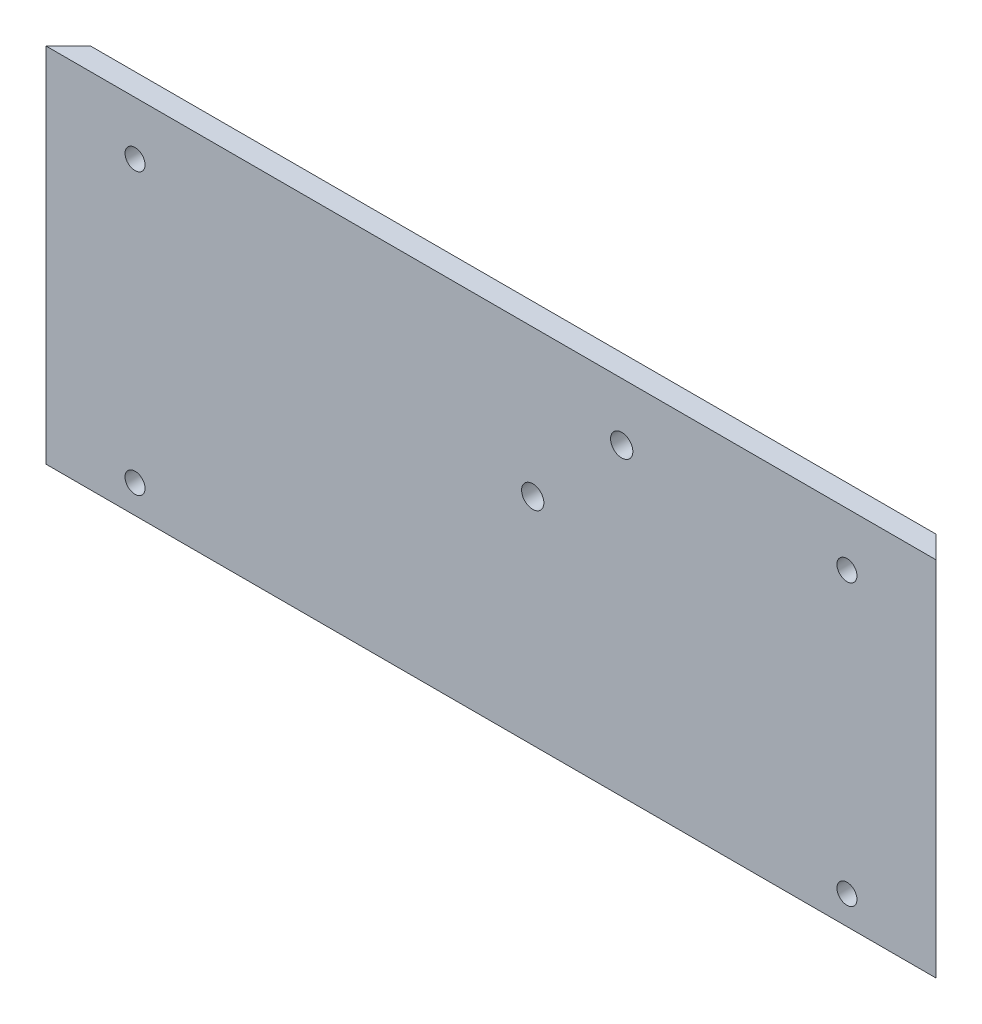
from build123d import *

# Parameters (mm, degrees)
SKETCH1_W           = 200
SKETCH1_H           = 84
SKETCH1_R           = 2.25
SKETCH1_R_2         = 2.5
BOSS_EXTRUDE1_DEPTH = 5
SKETCH2_W           = 200
SKETCH2_H           = 79
SKETCH2_R           = 2.25
BOSS_EXTRUDE2_DEPTH = 3
CHAMFER1_SIZE       = 8
CHAMFER3_SIZE       = 3
SKETCH3_W           = 7.071067812
SKETCH3_H           = 2.6
CUT_EXTRUDE1_DEPTH  = 234.034075139
SKETCH4_R           = 2.5
CUT_EXTRUDE2_DEPTH  = 218.071416819


with BuildPart() as part:
    # Sketch1 → Boss-Extrude1 (new body)
    with BuildSketch(Plane.XY):
        with Locations((100, 42)):
            Rectangle(SKETCH1_W, SKETCH1_H)
        with Locations((20, 9)):
            Circle(SKETCH1_R, mode=Mode.SUBTRACT)
        with Locations(Location((180, 9, 0), (0, 0, 180))):
            Circle(SKETCH1_R, mode=Mode.SUBTRACT)
        with Locations((20, 72)):
            Circle(SKETCH1_R, mode=Mode.SUBTRACT)
        with Locations(Location((180, 72, 0), (0, 0, 180))):
            Circle(SKETCH1_R, mode=Mode.SUBTRACT)
        with Locations((109.377508284, 51)):
            Circle(SKETCH1_R_2, mode=Mode.SUBTRACT)
        with Locations((129.377508284, 71)):
            Circle(SKETCH1_R_2, mode=Mode.SUBTRACT)
    extrude(amount=-BOSS_EXTRUDE1_DEPTH)

    # Sketch2 → Boss-Extrude2 (add)
    with BuildSketch(Plane(origin=(0, 0, -5), x_dir=(-1, 0, 0), z_dir=(0, 0, -1))):
        with Locations((-100, 44.5)):
            Rectangle(SKETCH2_W, SKETCH2_H)
        with Locations(Location((-20, 9, 0), (0, 0, 180))):
            Circle(SKETCH2_R, mode=Mode.SUBTRACT)
        with Locations((-180, 9)):
            Circle(SKETCH2_R, mode=Mode.SUBTRACT)
        with Locations(Location((-20, 72, 0), (0, 0, 180))):
            Circle(SKETCH2_R, mode=Mode.SUBTRACT)
        with Locations((-180, 72)):
            Circle(SKETCH2_R, mode=Mode.SUBTRACT)
    extrude(amount=BOSS_EXTRUDE2_DEPTH)

    # Chamfer1
    # the kernel refuses this chamfer: 8 mm, written as the material it takes off along each edge
    with BuildSketch(Plane(origin=(200, -15.573463904, -8), x_dir=(-0.9996219169112968, 0, -0.027495876610586296), z_dir=(0, 1, 0)), Plane(origin=(0, 104.573463904, -8), x_dir=(0.9996219169112968, 0, -0.027495876610586275), z_dir=(0, -1, 0))) as chamfer1_piece_1:
        Polygon((CHAMFER1_SIZE * 0.999621916911, CHAMFER1_SIZE * 0.0274958766106), (-CHAMFER1_SIZE * 0.0274958766106, CHAMFER1_SIZE * 0.999621916911), (0, 0), align=None)
    extrude(amount=120.146927807, mode=Mode.SUBTRACT)

    # Chamfer3
    chamfer3_edges = [part.edges().sort_by_distance(p)[0] for p in [
        (100, 84, -8),
    ]]
    chamfer(chamfer3_edges, length=CHAMFER3_SIZE)

    # Sketch3 → Cut-Extrude1 (cut, through all, along a direction that is not the sketch's normal)
    with BuildSketch(Plane(origin=(100, 0, -100), x_dir=(-0.7071067811865452, 0, -0.7071067811865498), z_dir=(0.7071067811865498, 0, -0.7071067811865452))):
        with Locations((-137.885822331, 1.3)):
            Rectangle(SKETCH3_W, SKETCH3_H)
    extrude(amount=-CUT_EXTRUDE1_DEPTH, dir=(1, 0, 0), mode=Mode.SUBTRACT)

    # Sketch4 → Cut-Extrude2 (cut, through all)
    with BuildSketch(Plane.XY):
        with Locations((129.377508284, 71)):
            Circle(SKETCH4_R)
        with Locations((109.377508284, 51)):
            Circle(SKETCH4_R)
    extrude(amount=-CUT_EXTRUDE2_DEPTH, mode=Mode.SUBTRACT)


solid = part.part
